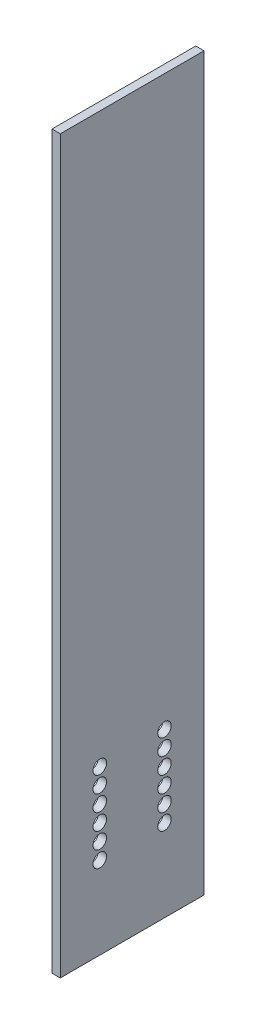
from build123d import *

# Parameters (mm, degrees)
SKETCH1_W                  = 56.4388
SKETCH1_H                  = 287.02
BOSS_EXTRUDE1_DEPTH        = 3.2512
F_4_0_209_DIAMETER_HOLE1_D = 5.3086
LPATTERN1_COUNT            = 4
LPATTERN1_PITCH            = 6.35
LPATTERN1_COL_COUNT        = 3
LPATTERN1_COL_PITCH        = 6.35


with BuildPart() as part:
    # Sketch1 → Boss-Extrude1 (new body)
    with BuildSketch(Plane(origin=(0, 0, 0), x_dir=(0, 0, -1), z_dir=(1, 0, 0))):
        Rectangle(SKETCH1_W, SKETCH1_H)
    extrude(amount=BOSS_EXTRUDE1_DEPTH)

    # #4 (0.209) Diameter Hole1 (through all)
    with Locations(Plane.ZY):
        with Locations((-12.7, -98.5012), (12.7, -98.5012)):
            f_4_0_209_diameter_hole1 = Hole(F_4_0_209_DIAMETER_HOLE1_D / 2)

    # LPattern1: #4 (0.209) Diameter Hole1 ×4
    with Locations(*[(0, i * LPATTERN1_PITCH, 0) for i in range(1, LPATTERN1_COUNT)]):
        add(f_4_0_209_diameter_hole1, mode=Mode.SUBTRACT)

    # LPattern1 col: #4 (0.209) Diameter Hole1 ×3
    with Locations(*[(0, -i * LPATTERN1_COL_PITCH, 0) for i in range(1, LPATTERN1_COL_COUNT)]):
        add(f_4_0_209_diameter_hole1, mode=Mode.SUBTRACT)


solid = part.part
